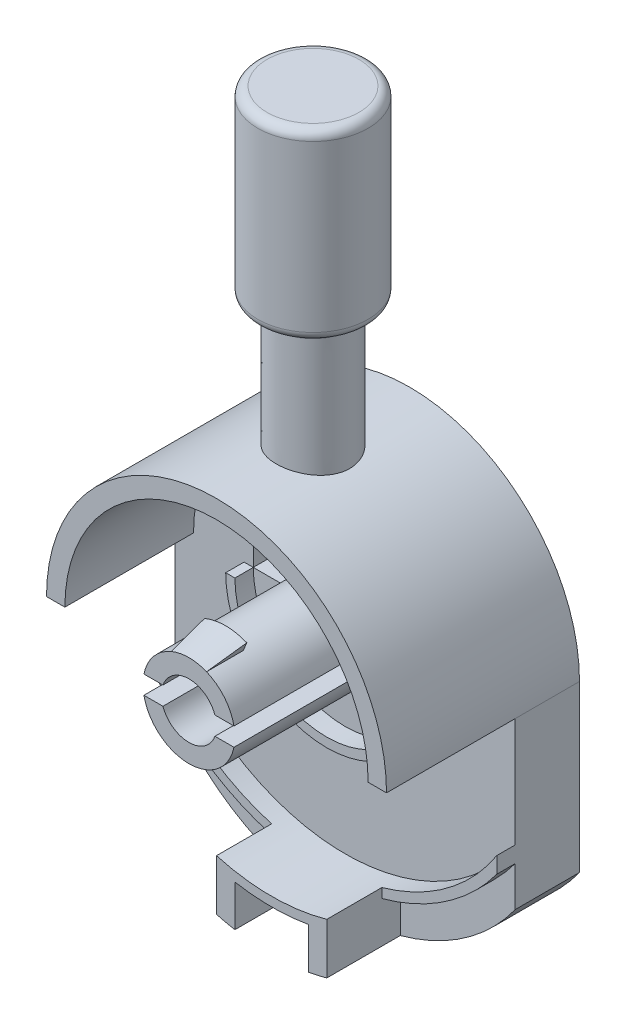
from build123d import *

# Parameters (mm, degrees)
ESTRUSIONE_ESTRUSIONE1_DEPTH   = 5.25
TAGLIO_ESTRUSIONE2_DEPTH       = 20.369051506
TAGLIO_ESTRUSIONE2_DEPTH_BACK  = 20.369051506
TAGLIO_ESTRUSIONE3_START       = 5.25
TAGLIO_ESTRUSIONE3_DEPTH       = 7
ESTRUSIONE_ESTRUSIONE2_START   = -5.25
SCHIZZO4_R                     = 1
ESTRUSIONE_ESTRUSIONE2_DEPTH   = 3
ESTRUSIONE_ESTRUSIONE4_DEPTH   = 1
ESTRUSIONE_ESTRUSIONE5_START   = -1.75
ESTRUSIONE_ESTRUSIONE5_DEPTH   = 8.5
ESTRUSIONE_SOTTILE1_START      = -1.75
ESTRUSIONE_SOTTILE1_DEPTH      = 1
ESTRUSIONE_ESTRUSIONE6_START   = 2.968695845
ESTRUSIONE_ESTRUSIONE6_DEPTH   = 9.218804255
ESTRUSIONE_ESTRUSIONE6_START_2 = -3
ESTRUSIONE_ESTRUSIONE6_2_DEPTH = 6
ESTRUSIONE_ESTRUSIONE7_START   = 10
SCHIZZO10_R                    = 3
ESTRUSIONE_ESTRUSIONE7_DEPTH   = 10
RACCORDO2_R                    = 0.5
RACCORDO3_R                    = 0.5
RIVOLUZIONE1_ANGLE             = 45
ESTRUSIONE_ESTRUSIONE8_START   = -1.75
ESTRUSIONE_ESTRUSIONE8_DEPTH   = 1
ESTRUSIONE_ESTRUSIONE9_DEPTH   = 4
RACCORDO4_R                    = 0.5


with BuildPart() as part:
    # Schizzo1 → Estrusione-Estrusione1 (new, symmetric)
    with BuildSketch(Plane.XY):
        with BuildLine():
            Line((-9.25, 6.9375), (-9.25, -2.0625))
            ThreePointArc((-9.25, -2.0625), (0, -6.8125), (9.25, -2.0625))
            Line((9.25, -2.0625), (9.25, 6.9375))
            ThreePointArc((9.25, 6.9375), (0, 16.1875), (-9.25, 6.9375))
        make_face()
    extrude(amount=ESTRUSIONE_ESTRUSIONE1_DEPTH, both=True)

    # Schizzo2 → Taglio-Estrusione2 (cut, two sides: drawn at the far end of the back side and taken through both)
    with BuildSketch(Plane.XY.offset(-TAGLIO_ESTRUSIONE2_DEPTH_BACK)):
        with BuildLine():
            Line((2.5, 6.9375), (5, 6.9375))
            Line((5, 6.9375), (5, 10.9375))
            Line((5, 10.9375), (-5, 10.9375))
            Line((-5, 10.9375), (-5, 6.9375))
            Line((-5, 6.9375), (-2.5, 6.9375))
            ThreePointArc((-2.5, 6.9375), (0, 9.4375), (2.5, 6.9375))
        make_face()
    extrude(amount=TAGLIO_ESTRUSIONE2_DEPTH + TAGLIO_ESTRUSIONE2_DEPTH_BACK, mode=Mode.SUBTRACT)

    # Schizzo3 → Taglio-Estrusione3 (cut)
    with BuildSketch(Plane.XY.offset(TAGLIO_ESTRUSIONE3_START)):
        with BuildLine():
            Line((9.25, -2.0625), (9.25, 6.9375))
            Line((9.25, 6.9375), (8.25, 6.9375))
            ThreePointArc((8.25, 6.9375), (0, 15.1875), (-8.25, 6.9375))
            Line((-8.25, 6.9375), (-9.25, 6.9375))
            Line((-9.25, 6.9375), (-9.25, -2.0625))
            ThreePointArc((-9.25, -2.0625), (0, -6.8125), (9.25, -2.0625))
        make_face()
    extrude(amount=-TAGLIO_ESTRUSIONE3_DEPTH, mode=Mode.SUBTRACT)

    # Schizzo4 → Estrusione-Estrusione2 (add)
    with BuildSketch(Plane.XY.offset(ESTRUSIONE_ESTRUSIONE2_START)):
        with Locations((0, -1.5625)):
            Circle(SCHIZZO4_R)
    extrude(amount=-ESTRUSIONE_ESTRUSIONE2_DEPTH)

    # Schizzo6 → Estrusione-Estrusione4 (add)
    with BuildSketch(Plane(origin=(0, 0, -5.25), x_dir=(-1, 0, 0), z_dir=(0, 0, -1))):
        with BuildLine():
            Line((-5, -4.529117656), (-5, -5.655418074))
            ThreePointArc((-5, -5.655418074), (0, -6.8125), (5, -5.655418074))
            Line((5, -5.655418074), (5, -4.529117656))
            ThreePointArc((5, -4.529117656), (0, -5.8125), (-5, -4.529117656))
        make_face()
    extrude(amount=ESTRUSIONE_ESTRUSIONE4_DEPTH)

    # Schizzo7 → Estrusione-Estrusione5 (add)
    with BuildSketch(Plane.XY.offset(ESTRUSIONE_ESTRUSIONE5_START)):
        with BuildLine():
            Line((-2.449489743, 7.4375), (-1.414213562, 7.4375))
            ThreePointArc((-1.414213562, 7.4375), (0, 8.4375), (1.414213562, 7.4375))
            Line((1.414213562, 7.4375), (2.449489743, 7.4375))
            ThreePointArc((2.449489743, 7.4375), (0, 9.4375), (-2.449489743, 7.4375))
        make_face()
        with BuildLine():
            Line((-2.449489743, 6.4375), (-1.414213562, 6.4375))
            ThreePointArc((-1.414213562, 6.4375), (0, 5.4375), (1.414213562, 6.4375))
            Line((1.414213562, 6.4375), (2.449489743, 6.4375))
            ThreePointArc((2.449489743, 6.4375), (0, 4.4375), (-2.449489743, 6.4375))
        make_face()
    extrude(amount=ESTRUSIONE_ESTRUSIONE5_DEPTH)

    # Schizzo8 → Estrusione-Sottile1 (add)
    with BuildSketch(Plane.XY.offset(ESTRUSIONE_SOTTILE1_START)):
        with BuildLine():
            ThreePointArc((-5, 6.9375), (0, 1.9375), (5, 6.9375))
            Line((5, 6.9375), (5.5, 6.9375))
            ThreePointArc((5.5, 6.9375), (0, 1.4375), (-5.5, 6.9375))
            Line((-5.5, 6.9375), (-5, 6.9375))
        make_face()
    extrude(amount=ESTRUSIONE_SOTTILE1_DEPTH)

    # Estrusione-Estrusione6: read off the stored shape, not the designer's step
    # Estrusione-Estrusione6 outline → Estrusione-Estrusione6 (add)
    with BuildSketch(Plane(origin=(0, 13, 0), x_dir=(1, 0, 0), z_dir=(0, 1, 0)).offset(ESTRUSIONE_ESTRUSIONE6_START)):
        with BuildLine():
            add(Edge.make_bspline(
                [(0, 2), (-0.530195322, 2), (-1.046723242, 1.781824246), (-1.782166815, 1.046139872), (-1.999682314, 0.524661024), (-2.000316951, -0.522236196), (-1.785791754, -1.042499455), (-1.0431527, -1.785410246), (-0.523753343, -1.999784453), (0.522105878, -2.000215207), (1.043983139, -1.783830966), (1.782095724, -1.046942473), (1.999655227, -0.52939958), (2.000343922, 0.526791359), (1.782458555, 1.045431658), (1.048031165, 1.780931366), (0.530195322, 2), (0, 2)],
                knots=[0, 0, 0, 0, 0.125, 0.125, 0.25, 0.25, 0.375, 0.375, 0.5, 0.5, 0.625, 0.625, 0.75, 0.75, 0.875, 0.875, 1, 1, 1, 1], degree=3))
        make_face()
    extrude(amount=ESTRUSIONE_ESTRUSIONE6_DEPTH)

    # Estrusione-Estrusione6 2 outline → Estrusione-Estrusione6 2 (cut)
    with BuildSketch(Plane.XY.offset(ESTRUSIONE_ESTRUSIONE6_START_2)):
        with BuildLine():
            Line((-3, 24.746410648), (-2.007175106, 24.967103983))
            ThreePointArc((-2.007175106, 24.967103983), (-1.009619517, 25.132235909), (8e-09, 25.1875))
            Line((8e-09, 25.1875), (-3, 25.1875001))
            Line((-3, 25.1875001), (-3, 24.746410648))
        make_face()
        with BuildLine():
            Line((3, 25.1875001), (8e-09, 25.1875))
            ThreePointArc((8e-09, 25.1875), (1.009647806, 25.132232803), (2.007230651, 24.967091636))
            Line((2.007230651, 24.967091636), (3, 24.74640424))
            Line((3, 24.74640424), (3, 25.1875001))
        make_face()
    extrude(amount=ESTRUSIONE_ESTRUSIONE6_2_DEPTH, mode=Mode.SUBTRACT)

    # Schizzo10 → Estrusione-Estrusione7 (add)
    with BuildSketch(Plane(origin=(0, 13, 0), x_dir=(1, 0, 0), z_dir=(0, 1, 0)).offset(ESTRUSIONE_ESTRUSIONE7_START)):
        with Locations(Location((0, 0, 0), (0, 0, 270))):
            Circle(SCHIZZO10_R)
    extrude(amount=ESTRUSIONE_ESTRUSIONE7_DEPTH)

    # Raccordo2
    raccordo2_edges = [part.edges().sort_by_distance(p)[0] for p in [
        (-4.777e-06, 23, 1.999999997),
    ]]
    fillet(raccordo2_edges, radius=RACCORDO2_R)

    # Raccordo3
    raccordo3_edges = [part.edges().sort_by_distance(p)[0] for p in [
        (0, 33, -3),
    ]]
    fillet(raccordo3_edges, radius=RACCORDO3_R)

    # Schizzo12 → Rivoluzione1 (revolve, symmetric)
    with BuildSketch(Plane(origin=(0, 0, 0), x_dir=(0, 0, -1), z_dir=(1, 0, 0))) as rivoluzione1_sk:
        Polygon((-6.75, 9.4375), (-4.75, 9.9375), (-4.75, 9.4375), align=None)
    revolve(axis=Axis((0, 6.9375, 6.75), (0, 0, -1)), revolution_arc=RIVOLUZIONE1_ANGLE / 2)
    revolve(rivoluzione1_sk.sketch, axis=Axis((0, 6.9375, 6.75), (0, 0, 1)), revolution_arc=RIVOLUZIONE1_ANGLE / 2)

    # Schizzo14 → Estrusione-Estrusione8 (add)
    with BuildSketch(Plane.XY.offset(ESTRUSIONE_ESTRUSIONE8_START)):
        with BuildLine():
            Line((9.25, 0.98455955), (9.25, 0.104674816))
            ThreePointArc((9.25, 0.104674816), (0, -4.5625), (-9.25, 0.104674816))
            Line((-9.25, 0.104674816), (-9.25, 0.98455955))
            ThreePointArc((-9.25, 0.98455955), (0, -4.0625), (9.25, 0.98455955))
        make_face()
    extrude(amount=ESTRUSIONE_ESTRUSIONE8_DEPTH)

    # Schizzo16 → Estrusione-Estrusione9 (add)
    with BuildSketch(Plane.XY.offset(-1.75)):
        with BuildLine():
            Line((-3, -6.410007505), (-3, -3.645505244))
            ThreePointArc((-3, -3.645505244), (0, -4.0625), (3, -3.645505244))
            Line((3, -3.645505244), (3, -6.410007505))
            ThreePointArc((3, -6.410007505), (2.502538791, -6.533967434), (2, -6.635399592))
            Line((2, -6.635399592), (2, -4.387251653))
            ThreePointArc((2, -4.387251653), (0, -4.5625), (-2, -4.387251653))
            Line((-2, -4.387251653), (-2, -6.635399592))
            ThreePointArc((-2, -6.635399592), (-2.502538791, -6.533967434), (-3, -6.410007505))
        make_face()
    extrude(amount=ESTRUSIONE_ESTRUSIONE9_DEPTH)

    # Raccordo4
    raccordo4_edges = [part.edges().sort_by_distance(p)[0] for p in [
        (0, 23, -3),
    ]]
    fillet(raccordo4_edges, radius=RACCORDO4_R - 0.0001)  # a hair under: the kernel refuses the full size


solid = part.part
